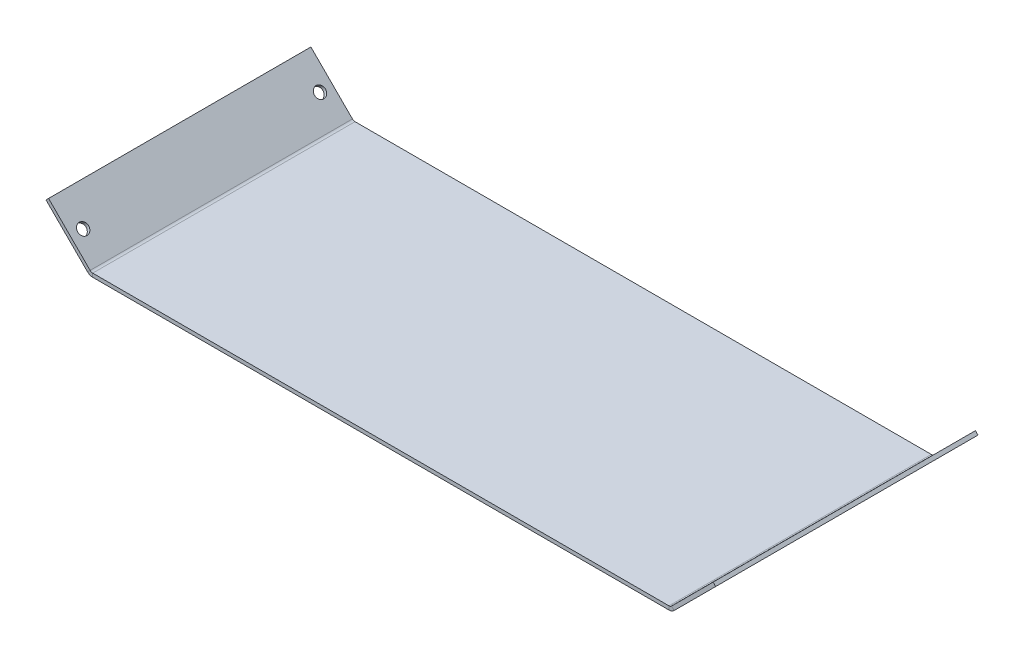
from build123d import *

# Parameters (mm, degrees)
BASE_FLANGE1_START             = -3.175
BASE_FLANGE1_OUTLINE_W         = 1009.65
BASE_FLANGE1_OUTLINE_H         = 457.2
BASE_FLANGE1_DEPTH             = 6.35
EDGE_FLANGE1_STRIP_CUT_DEPTH   = 457.2
EDGE_FLANGE1_STRIP_CUT_2_DEPTH = 457.2
EDGE_FLANGE1_DEPTH             = 457.2
EDGE_FLANGE1_BEND_DEPTH        = 457.2
SKETCH12_R                     = 9.525
CUT_EXTRUDE1_DEPTH             = 6.35
SKETCH13_R                     = 9.525
CUT_EXTRUDE2_DEPTH             = 6.35


# Read off the part's stored shape, not the designer's step: Base-Flange1
# Sheet-metal steps are written as plain solids
with BuildPart() as part:
    # Base-Flange1 outline → Base-Flange1 (new body)
    with BuildSketch(Plane(origin=(0, 0, 0), x_dir=(1, 0, 0), z_dir=(0, 1, 0)).offset(BASE_FLANGE1_START)):
        Rectangle(BASE_FLANGE1_OUTLINE_W, BASE_FLANGE1_OUTLINE_H)
    extrude(amount=BASE_FLANGE1_DEPTH)

    # Edge-Flange1 strip (across the edge) → Edge-Flange1 strip cut (cut)
    with BuildSketch(Plane(origin=(504.825, 3.175, 228.6), x_dir=(-0.7071067811865438, 0.7071067811865512, 0), z_dir=(0, 0, -1))):
        Polygon((-29.571024484, 20.590768363), (-2.630256121, -6.35), (1.859871939, -1.859871939), (-25.080896424, 25.080896424), align=None)
    extrude(amount=EDGE_FLANGE1_STRIP_CUT_DEPTH, mode=Mode.SUBTRACT)

    # Edge-Flange1 strip 2 (across the edge) → Edge-Flange1 strip cut 2 (cut)
    with BuildSketch(Plane(origin=(-504.825, 3.175, -228.6), x_dir=(0.7071067811865438, 0.7071067811865512, 0), z_dir=(0, 0, 1))):
        Polygon((-29.571024484, 20.590768363), (-2.630256121, -6.35), (1.859871939, -1.859871939), (-25.080896424, 25.080896424), align=None)
    extrude(amount=EDGE_FLANGE1_STRIP_CUT_2_DEPTH, mode=Mode.SUBTRACT)

    # Edge-Flange1 section (across the edge) → Edge-Flange1 (add)
    with BuildSketch(Plane(origin=(504.825, 3.175, 228.6), x_dir=(-0.7071067811865438, 0.7071067811865512, 0), z_dir=(0, 0, -1))):
        with BuildLine():
            Line((-6.35, 2.630256121), (-6.35, 105.065743879))
            Line((-6.35, 105.065743879), (0, 105.065743879))
            Line((0, 105.065743879), (0, 2.630256121))
            ThreePointArc((0, 2.630256121), (0.483364969, 0.200216326), (1.859871939, -1.859871939))
            Line((1.859871939, -1.859871939), (-2.630256121, -6.35))
            ThreePointArc((-2.630256121, -6.35), (-5.383270063, -2.22982347), (-6.35, 2.630256121))
        make_face()
    extrude(amount=EDGE_FLANGE1_DEPTH)

    # Edge-Flange1 section 2 (across the edge) → Edge-Flange1 bend (add)
    with BuildSketch(Plane(origin=(-504.825, 3.175, -228.6), x_dir=(0.7071067811865438, 0.7071067811865512, 0), z_dir=(0, 0, 1))):
        with BuildLine():
            Line((-6.35, 2.630256121), (-6.35, 105.065743879))
            Line((-6.35, 105.065743879), (0, 105.065743879))
            Line((0, 105.065743879), (0, 2.630256121))
            ThreePointArc((0, 2.630256121), (0.483364969, 0.200216326), (1.859871939, -1.859871939))
            Line((1.859871939, -1.859871939), (-2.630256121, -6.35))
            ThreePointArc((-2.630256121, -6.35), (-5.383270063, -2.22982347), (-6.35, 2.630256121))
        make_face()
    extrude(amount=EDGE_FLANGE1_BEND_DEPTH)

    # Sketch12 → Cut-Extrude1 (cut)
    with BuildSketch(Plane(origin=(255.315128061, -255.315128061, 0), x_dir=(-0.7071067811865513, -0.7071067811865438, 0), z_dir=(0.7071067811865438, -0.7071067811865513, 0))):
        with Locations(Location((-410.427988722, -206.375, 0), (0, 0, 180))):
            Circle(SKETCH12_R)
        with Locations(Location((-410.427988722, 206.375, 0), (0, 0, 180))):
            Circle(SKETCH12_R)
    extrude(amount=-CUT_EXTRUDE1_DEPTH, mode=Mode.SUBTRACT)

    # Sketch13 → Cut-Extrude2 (cut)
    with BuildSketch(Plane(origin=(-255.315128061, -255.315128061, 0), x_dir=(0, 0, 1), z_dir=(-0.7071067811865442, -0.7071067811865509, 0))):
        with Locations(Location((-206.375, 410.427988722, 0), (0, 0, 270))):
            Circle(SKETCH13_R)
        with Locations(Location((206.375, 410.427988722, 0), (0, 0, 90))):
            Circle(SKETCH13_R)
    extrude(amount=-CUT_EXTRUDE2_DEPTH, mode=Mode.SUBTRACT)


solid = part.part
